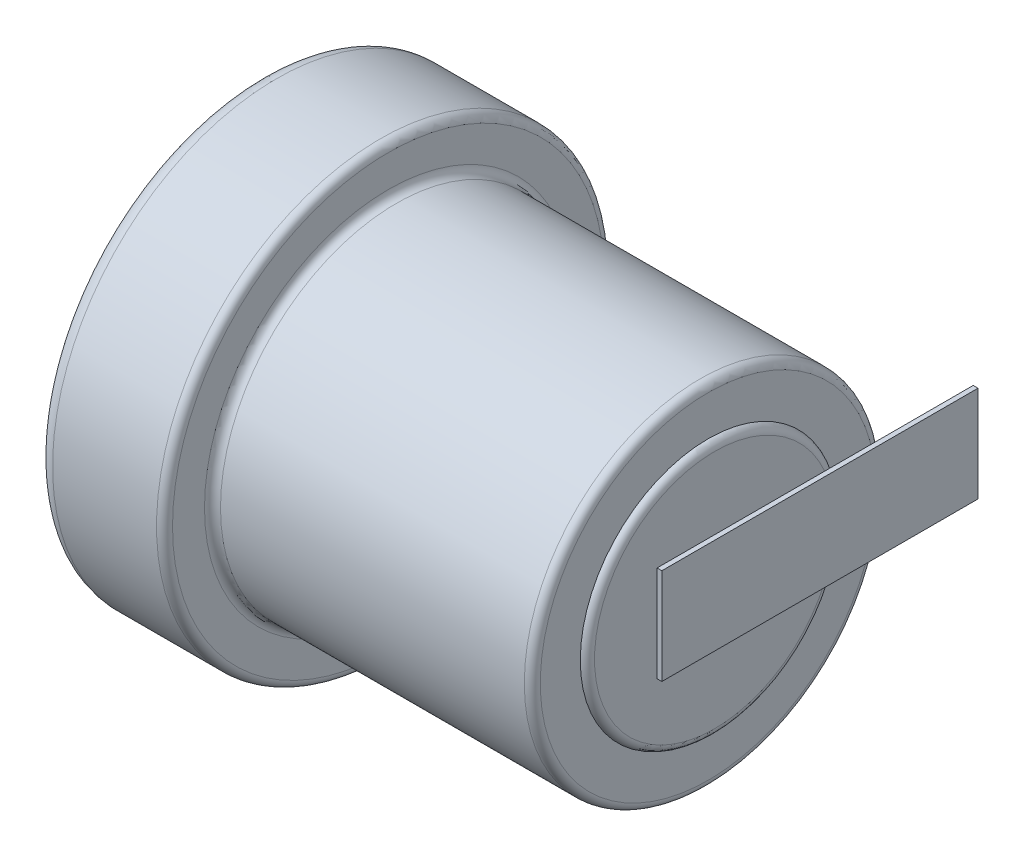
from build123d import *

# Parameters (mm, degrees)
SKETCH1_R           = 7
BOSS_EXTRUDE1_DEPTH = 4
SKETCH2_R           = 5.5
BOSS_EXTRUDE2_DEPTH = 10
SKETCH3_R           = 4
BOSS_EXTRUDE3_DEPTH = 0.2
SKETCH4_R           = 5
SKETCH4_R_2         = 4
CUT_EXTRUDE3_DEPTH  = 2
BOSS_EXTRUDE4_START = 0.4
SKETCH5_R           = 4
BOSS_EXTRUDE4_DEPTH = 0.4
FILLET1_R           = 0.25
FILLET2_R           = 0.25
FILLET3_R           = 0.5
FILLET4_R           = 1
FILLET5_R           = 0.25
BOSS_EXTRUDE5_DEPTH = 0.15
BOSS_EXTRUDE6_DEPTH = 3
BOSS_EXTRUDE7_DEPTH = 0.15
SKETCH11_W          = 0.15
SKETCH11_H          = 3
BOSS_EXTRUDE8_DEPTH = 6.286100837


with BuildPart() as part:
    # Sketch1 → Boss-Extrude1 (new body)
    with BuildSketch(Plane(origin=(0, 0, 0), x_dir=(0, 0, -1), z_dir=(1, 0, 0))):
        with Locations((-7, 0)):
            Circle(SKETCH1_R)
    extrude(amount=BOSS_EXTRUDE1_DEPTH)

    # Sketch2 → Boss-Extrude2 (add)
    with BuildSketch(Plane(origin=(4, 0, 0), x_dir=(0, 0, -1), z_dir=(1, 0, 0))):
        with Locations((-7, 0)):
            Circle(SKETCH2_R)
    extrude(amount=BOSS_EXTRUDE2_DEPTH)

    # Sketch3 → Boss-Extrude3 (add)
    with BuildSketch(Plane(origin=(14, 0, 0), x_dir=(0, 0, -1), z_dir=(1, 0, 0))):
        with Locations((-7, 0)):
            Circle(SKETCH3_R)
    extrude(amount=BOSS_EXTRUDE3_DEPTH)

    # Sketch4 → Cut-Extrude3 (cut)
    with BuildSketch(Plane.ZY):
        with Locations((7, 0)):
            Circle(SKETCH4_R)
        with Locations(Location((7, 0, 0), (0, 0, 180))):
            Circle(SKETCH4_R_2, mode=Mode.SUBTRACT)
    extrude(amount=-CUT_EXTRUDE3_DEPTH, mode=Mode.SUBTRACT)

    # Sketch5 → Boss-Extrude4 (add)
    with BuildSketch(Plane.ZY.offset(BOSS_EXTRUDE4_START)):
        with Locations(Location((7, 0, 0), (0, 0, 180))):
            Circle(SKETCH5_R)
    extrude(amount=-BOSS_EXTRUDE4_DEPTH)

    # Fillet1
    fillet1_edges = [part.edges().sort_by_distance(p)[0] for p in [
        (4, 0, 12.5),
    ]]
    fillet(fillet1_edges, radius=FILLET1_R)

    # Fillet2
    fillet2_edges = [part.edges().sort_by_distance(p)[0] for p in [
        (4, 0, 14),
    ]]
    fillet(fillet2_edges, radius=FILLET2_R)

    # Fillet3
    fillet3_edges = [part.edges().sort_by_distance(p)[0] for p in [
        (0, 0, 14),
    ]]
    fillet(fillet3_edges, radius=FILLET3_R)

    # Fillet4
    fillet4_edges = [part.edges().sort_by_distance(p)[0] for p in [
        (-0.4, 0, 11),
    ]]
    fillet(fillet4_edges, radius=FILLET4_R)

    # Fillet5
    # the kernel refuses this fillet: 0.25 mm, written as the material it takes off along each edge
    with BuildSketch(Plane(origin=(14.2, 0, 7), x_dir=(0, 0, -1), z_dir=(0, -1, 0))) as fillet5_piece_1:
        with BuildLine():
            CenterArc((3.755051026, -0.25), FILLET5_R, 11.536959033, 78.463040967)
            Line((3.755051026, 0), (3.755051026, 0.005))
            Line((3.755051026, 0.005), (4, 0.005))
            Line((4, 0.005), (4.005, 0))
            ThreePointArc((4.005, 0), (4.005, -0.1), (4.004898979, -0.199))
            Line((4.004898979, -0.199), (4, -0.2))
        make_face()
    revolve(axis=Axis((14.2, 0, 7), (1, 0, 0)), mode=Mode.SUBTRACT)
    with BuildSketch(Plane(origin=(14, 0, 7), x_dir=(0, 0, -1), z_dir=(0, -1, 0))) as fillet5_piece_2:
        with BuildLine():
            CenterArc((5.5 - FILLET5_R, -FILLET5_R), FILLET5_R, 0, 90)
            Line((5.5 - FILLET5_R, 0), (5.5 - FILLET5_R, FILLET5_R * 0.02))
            Line((5.5 - FILLET5_R, FILLET5_R * 0.02), (5.5 + FILLET5_R * 0.02, FILLET5_R * 0.02))
            Line((5.5 + FILLET5_R * 0.02, FILLET5_R * 0.02), (5.5 + FILLET5_R * 0.02, -FILLET5_R))
            Line((5.5 + FILLET5_R * 0.02, -FILLET5_R), (5.5, -FILLET5_R))
        make_face()
    revolve(axis=Axis((14, 0, 7), (1, 0, 0)), mode=Mode.SUBTRACT)

    # Sketch6 → Boss-Extrude5 (add)
    with BuildSketch(Plane.ZY.offset(0.4)):
        Polygon((7, -1.5), (8.8, -1.5), (8.8, 1.5), (5.2, 1.5), (5.2, -1.5), align=None)
    extrude(amount=BOSS_EXTRUDE5_DEPTH)

    # Sketch7 → Boss-Extrude6 (add)
    with BuildSketch(Plane.XZ.offset(1.5)):
        Polygon((-0.55, 5.2), (-3.095584412, 2.654415588), (-3.155067988, 2.513899163), (-3.155067988, -1.086100837), (-2.955067988, -1.086100837), (-2.955067988, 2.513899163), (-0.409483576, 5.059483576), (-0.4, 5.2), align=None)
    extrude(amount=-BOSS_EXTRUDE6_DEPTH)

    # Sketch8 → Boss-Extrude7 (add)
    with BuildSketch(Plane(origin=(14.2, 0, 0), x_dir=(0, 0, -1), z_dir=(1, 0, 0))):
        Polygon((-7, -1.5), (-8.8, -1.5), (-8.8, 1.5), (-5.2, 1.5), (-5.2, -1.5), align=None)
    extrude(amount=BOSS_EXTRUDE7_DEPTH)

    # Sketch11 → Boss-Extrude8 (add)
    with BuildSketch(Plane(origin=(0, 0, 5.2), x_dir=(-1, 0, 0), z_dir=(0, 0, -1))):
        with Locations((-14.275, 0)):
            Rectangle(SKETCH11_W, SKETCH11_H)
    extrude(amount=BOSS_EXTRUDE8_DEPTH)


solid = part.part
